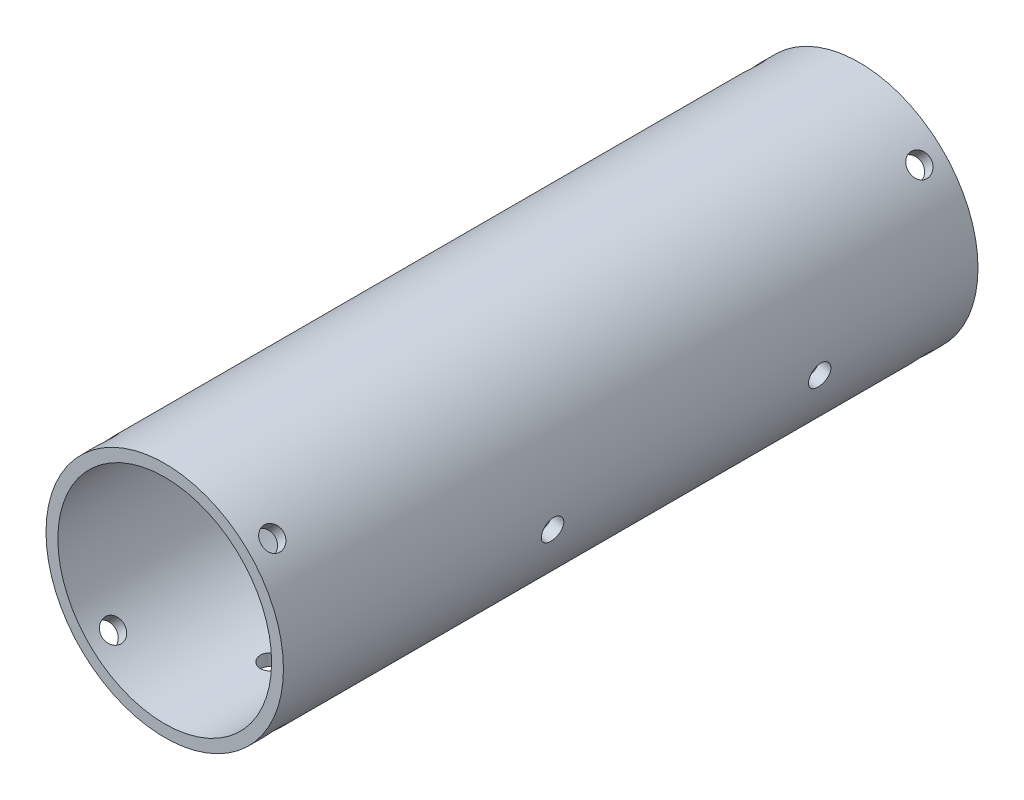
from build123d import *
from build123d.topology import SkipClean

# Parameters (mm, degrees)
SKETCH1_R               = 20
SKETCH1_R_2             = 18
BOSS_EXTRUDE1_DEPTH     = 100
CUT_EXTRUDE1_REACH      = 112.122
CUT_EXTRUDE1_END_RADIUS = 18
SKETCH3_R               = 1.875
SKETCH4_R               = 1.875
CUT_EXTRUDE2_DEPTH      = 23
BOSS_EXTRUDE2_START     = 9
SKETCH5_R               = 20
SKETCH5_R_2             = 18
BOSS_EXTRUDE2_DEPTH     = 9
SKETCH6_R               = 20
SKETCH6_R_2             = 18
BOSS_EXTRUDE3_DEPTH     = 8
CUT_EXTRUDE3_REACH      = 120.302
SKETCH7_R               = 1.875
CIRPATTERN1_COUNT       = 4
MIRROR2_COPY_1_REACH    = 120.302
MIRROR2_COPY_1_SKETCH_R = 1.875
MIRROR2_COPY_2_REACH    = 120.302
MIRROR2_COPY_2_SKETCH_R = 1.875
MIRROR2_COPY_3_REACH    = 120.302
MIRROR2_COPY_3_SKETCH_R = 1.875


with BuildPart() as part:
    # Sketch1 → Boss-Extrude1 (new body)
    with BuildSketch(Plane.XY):
        Circle(SKETCH1_R)
        Circle(SKETCH1_R_2, mode=Mode.SUBTRACT)
    extrude(amount=BOSS_EXTRUDE1_DEPTH)

    # Cut-Extrude1: up to this cylinder (the profile starts outside it)
    cut_extrude1_end = Plane(origin=(0, 0, 40), z_dir=(0, 0, -1)) * Cylinder(CUT_EXTRUDE1_END_RADIUS, 306.244, mode=Mode.PRIVATE)
    # Sketch3 → Cut-Extrude1 (cut, up to the surface)
    with BuildSketch(Plane(origin=(-19.69615506, -3.472963553, 0), x_dir=(0, 0, -1), z_dir=(-0.9848077530122086, -0.17364817766692736, 0)), mode=Mode.PRIVATE) as cut_extrude1_sk1:
        with Locations((-62.5, -0.968727398)):
            Circle(SKETCH3_R)
    cut_extrude1_tool1 = extrude(cut_extrude1_sk1.sketch, amount=-CUT_EXTRUDE1_REACH, mode=Mode.PRIVATE) - cut_extrude1_end
    # Sketch3 → Cut-Extrude1 (cut, up to the surface)
    with BuildSketch(Plane(origin=(-19.69615506, -3.472963553, 0), x_dir=(0, 0, -1), z_dir=(-0.9848077530122086, -0.17364817766692736, 0)), mode=Mode.PRIVATE) as cut_extrude1_sk2:
        with Locations((-17.5, -0.968727398)):
            Circle(SKETCH3_R)
    cut_extrude1_tool2 = extrude(cut_extrude1_sk2.sketch, amount=-CUT_EXTRUDE1_REACH, mode=Mode.PRIVATE) - cut_extrude1_end
    cut_extrude1 = cut_extrude1_tool1.solids().sort_by_distance((-19.864373, -2.518953, 62.5))[0] + cut_extrude1_tool2.solids().sort_by_distance((-19.864373, -2.518953, 17.5))[0]
    add(cut_extrude1, mode=Mode.SUBTRACT)

    # Mirror1: Cut-Extrude1 across plane
    add(cut_extrude1.mirror(Plane(origin=(0, 0, 0), x_dir=(0, 0, 1), z_dir=(1, 0, 0))), mode=Mode.SUBTRACT)

    # Sketch4 → Cut-Extrude2 (cut)
    with BuildSketch(Plane(origin=(0, 0, 0), x_dir=(1, 0, 0), z_dir=(0, 1, 0))):
        with Locations((0, -90)):
            Circle(SKETCH4_R)
    extrude(amount=-CUT_EXTRUDE2_DEPTH, mode=Mode.SUBTRACT)

    # Sketch5 → Boss-Extrude2 (add)
    with BuildSketch(Plane(origin=(0, 0, 0), x_dir=(-1, 0, 0), z_dir=(0, 0, -1)).offset(BOSS_EXTRUDE2_START)):
        Circle(SKETCH5_R)
        Circle(SKETCH5_R_2, mode=Mode.SUBTRACT)
    extrude(amount=-BOSS_EXTRUDE2_DEPTH)

    # Sketch6 → Boss-Extrude3 (add)
    with SkipClean():  # the faces are left unmerged after this step: merging them gives an invalid solid
        with BuildSketch(Plane.XY.offset(100)):
            Circle(SKETCH6_R)
            Circle(SKETCH6_R_2, mode=Mode.SUBTRACT)
        extrude(amount=BOSS_EXTRUDE3_DEPTH)

    # Sketch7 → Cut-Extrude3 (cut, up to next)
    with BuildSketch(Plane(origin=(-14.142135624, -14.142135624, 0), x_dir=(0, 0, -1), z_dir=(-0.7071067811865488, -0.7071067811865464, 0)), mode=Mode.PRIVATE) as cut_extrude3_sk1:
        with Locations((-104, 0)):
            Circle(SKETCH7_R)
    cut_extrude3_tool1 = extrude(cut_extrude3_sk1.sketch, amount=-CUT_EXTRUDE3_REACH, mode=Mode.PRIVATE) & part.part
    cut_extrude3 = cut_extrude3_tool1.solids().sort_by_distance((-14.142136, -14.142136, 104))[0]
    add(cut_extrude3, mode=Mode.SUBTRACT)

    # CirPattern1: Cut-Extrude3 ×4 about axis
    with SkipClean():  # the faces are left unmerged after this step: merging them gives an invalid solid
        cirpattern1_axis = Axis((0, 0, 100), (0, 0, -1))
        for i in range(1, CIRPATTERN1_COUNT):
            add(cut_extrude3.rotate(cirpattern1_axis, i * 360 / CIRPATTERN1_COUNT), mode=Mode.SUBTRACT)

    # Mirror2: Cut-Extrude3 across plane
    with SkipClean():  # the faces are left unmerged after this step: merging them gives an invalid solid
        add(cut_extrude3.mirror(Plane.XY.offset(49.5)), mode=Mode.SUBTRACT)

    # Mirror2 copy 1 sketch → Mirror2 copy 1 (cut, up to next)
    with BuildSketch(Plane(origin=(-14.142135624, 14.142135624, 99), x_dir=(0, 0, 1), z_dir=(-0.7071067811865464, 0.7071067811865488, 0)), mode=Mode.PRIVATE) as mirror2_copy_1_sk1:
        with Locations((-104, 0)):
            Circle(MIRROR2_COPY_1_SKETCH_R)
    mirror2_copy_1_tool1 = extrude(mirror2_copy_1_sk1.sketch, amount=-MIRROR2_COPY_1_REACH, mode=Mode.PRIVATE) & part.part
    add(mirror2_copy_1_tool1.solids().sort_by_distance((-14.142136, 14.142136, -5))[0], mode=Mode.SUBTRACT)

    # Mirror2 copy 2 sketch → Mirror2 copy 2 (cut, up to next)
    with BuildSketch(Plane(origin=(14.142135624, 14.142135624, 99), x_dir=(0, 0, 1), z_dir=(0.7071067811865487, 0.7071067811865465, 0)), mode=Mode.PRIVATE) as mirror2_copy_2_sk1:
        with Locations((-104, 0)):
            Circle(MIRROR2_COPY_2_SKETCH_R)
    mirror2_copy_2_tool1 = extrude(mirror2_copy_2_sk1.sketch, amount=-MIRROR2_COPY_2_REACH, mode=Mode.PRIVATE) & part.part
    add(mirror2_copy_2_tool1.solids().sort_by_distance((14.142136, 14.142136, -5))[0], mode=Mode.SUBTRACT)

    # Mirror2 copy 3 sketch → Mirror2 copy 3 (cut, up to next)
    with BuildSketch(Plane(origin=(14.142135624, -14.142135624, 99), x_dir=(0, 0, 1), z_dir=(0.7071067811865465, -0.7071067811865487, 0)), mode=Mode.PRIVATE) as mirror2_copy_3_sk1:
        with Locations((-104, 0)):
            Circle(MIRROR2_COPY_3_SKETCH_R)
    mirror2_copy_3_tool1 = extrude(mirror2_copy_3_sk1.sketch, amount=-MIRROR2_COPY_3_REACH, mode=Mode.PRIVATE) & part.part
    add(mirror2_copy_3_tool1.solids().sort_by_distance((14.142136, -14.142136, -5))[0], mode=Mode.SUBTRACT)


solid = part.part
